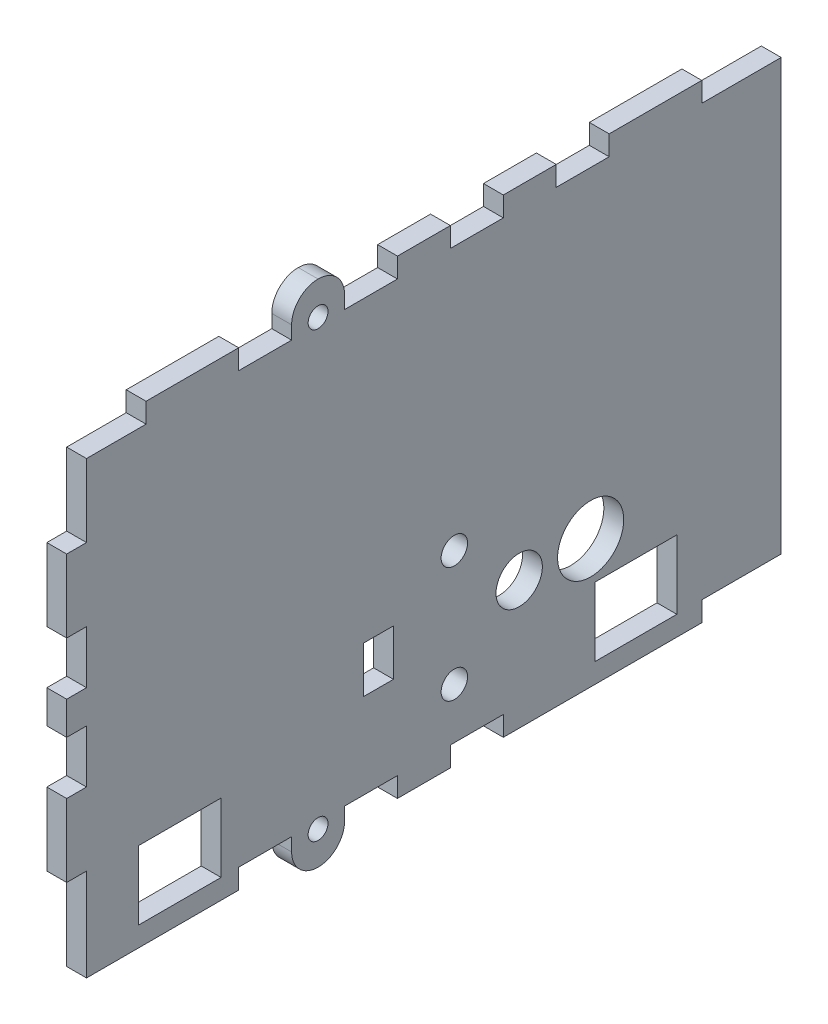
from build123d import *

# Parameters (mm, degrees)
CROQUIS1_W               = 108
CROQUIS1_H               = 71
SALIENTE_EXTRUIR1_DEPTH  = 1.5
CROQUIS2_W               = 12
CROQUIS2_H               = 3
CROQUIS2_W_2             = 8
CORTAR_EXTRUIR1_DEPTH    = 3
CROQUIS6_W               = 3
CROQUIS6_H               = 14
CROQUIS6_H_2             = 8
CORTAR_EXTRUIR3_DEPTH    = 3
CROQUIS8_W               = 8
CROQUIS8_H               = 3
SALIENTE_EXTRUIR2_DEPTH  = 3
REDONDEO2_R              = 4
CROQUIS9_R               = 1.5
CORTAR_EXTRUIR5_DEPTH    = 3
REDONDEO2_OF_SIMETR_A1_R = 4
CROQUIS12_W              = 12.481361742
CROQUIS12_H              = 10.4
CROQUIS12_W_2            = 12.356019523
CORTAR_EXTRUIR7_DEPTH    = 10
CROQUIS10_R              = 4.6
CROQUIS10_R_2            = 3.5
CROQUIS10_R_3            = 2
CROQUIS10_W              = 4.5
CROQUIS10_H              = 7
CORTAR_EXTRUIR6_DEPTH    = 10
CROQUIS14_R              = 5
CROQUIS14_R_2            = 0.007419035
CORTAR_EXTRUIR9_DEPTH    = 10


with BuildPart() as part:
    # Croquis1 → Saliente-Extruir1 (new, symmetric)
    with BuildSketch(Plane(origin=(0, 0, 0), x_dir=(0, 0, -1), z_dir=(1, 0, 0))):
        Rectangle(CROQUIS1_W, CROQUIS1_H)
    extrude(amount=SALIENTE_EXTRUIR1_DEPTH, both=True)

    # Croquis2 → Cortar-Extruir1 (cut)
    with BuildSketch(Plane.ZY.offset(1.5)):
        with Locations((-48, -34)):
            Rectangle(CROQUIS2_W, CROQUIS2_H)
        with Locations((-8, -34)):
            Rectangle(CROQUIS2_W_2, CROQUIS2_H)
        with Locations((48, 34)):
            Rectangle(CROQUIS2_W, CROQUIS2_H)
        with Locations((24, 34)):
            Rectangle(CROQUIS2_W_2, CROQUIS2_H)
        with Locations((8, 34)):
            Rectangle(CROQUIS2_W_2, CROQUIS2_H)
        with Locations((-8, 34)):
            Rectangle(CROQUIS2_W_2, CROQUIS2_H)
        with Locations((-24, 34)):
            Rectangle(CROQUIS2_W_2, CROQUIS2_H)
        with Locations((-48, 34)):
            Rectangle(CROQUIS2_W, CROQUIS2_H)
        with Locations((8, -34)):
            Rectangle(CROQUIS2_W_2, CROQUIS2_H)
        with Locations((24, -34)):
            Rectangle(CROQUIS2_W_2, CROQUIS2_H)
    extrude(amount=-CORTAR_EXTRUIR1_DEPTH, mode=Mode.SUBTRACT)

    # Croquis6 → Cortar-Extruir3 (cut)
    with BuildSketch(Plane.ZY.offset(1.5)):
        with Locations((52.5, -28.5)):
            Rectangle(CROQUIS6_W, CROQUIS6_H)
        with Locations((52.5, -6.5)):
            Rectangle(CROQUIS6_W, CROQUIS6_H_2)
        with Locations((52.5, 6.5)):
            Rectangle(CROQUIS6_W, CROQUIS6_H_2)
        with Locations((52.5, 28.5)):
            Rectangle(CROQUIS6_W, CROQUIS6_H)
    extrude(amount=-CORTAR_EXTRUIR3_DEPTH, mode=Mode.SUBTRACT)

    # Croquis8 → Saliente-Extruir2 (add)
    with BuildSketch(Plane.ZY.offset(1.5)):
        with Locations((16, 37)):
            Rectangle(CROQUIS8_W, CROQUIS8_H)
    saliente_extruir2 = extrude(amount=-SALIENTE_EXTRUIR2_DEPTH)

    # Redondeo2
    redondeo2_edges = [part.edges().sort_by_distance(p)[0] for p in [
        (0, 38.5, 20),
        (0, 38.5, 12),
    ]]
    fillet(redondeo2_edges, radius=REDONDEO2_R - 0.0001)  # a hair under: the kernel refuses the full size

    # Croquis9 → Cortar-Extruir5 (cut)
    with BuildSketch(Plane.ZY.offset(1.5)):
        with Locations((16, 33.5)):
            Circle(CROQUIS9_R)
    cortar_extruir5 = extrude(amount=-CORTAR_EXTRUIR5_DEPTH, mode=Mode.SUBTRACT)

    # Simetría1: Saliente-Extruir2, Cortar-Extruir5 across plane
    add(saliente_extruir2.mirror(Plane.ZX))
    add(cortar_extruir5.mirror(Plane.ZX), mode=Mode.SUBTRACT)

    # Redondeo2 of Simetría1
    redondeo2_of_simetr_a1_edges = [part.edges().sort_by_distance(p)[0] for p in [
        (0, -38.5, 20),
        (0, -38.5, 12),
    ]]
    fillet(redondeo2_of_simetr_a1_edges, radius=REDONDEO2_OF_SIMETR_A1_R - 0.0001)  # a hair under: the kernel refuses the full size

    # Croquis12 → Cortar-Extruir7 (cut)
    with BuildSketch(Plane.ZY.offset(1.5)):
        with Locations((36.9, -27.305454422)):
            Rectangle(CROQUIS12_W, CROQUIS12_H)
        with Locations((-32.051890368, -27.305454422)):
            Rectangle(CROQUIS12_W_2, CROQUIS12_H)
    extrude(amount=-CORTAR_EXTRUIR7_DEPTH, mode=Mode.SUBTRACT)

    # Croquis10 → Cortar-Extruir6 (cut)
    with BuildSketch(Plane.ZY.offset(1.5)):
        with Locations((-25.2, -16.1)):
            Circle(CROQUIS10_R)
        with Locations((-14.4, -16.1)):
            Circle(CROQUIS10_R_2)
        with Locations((-4.6, -24.85)):
            Circle(CROQUIS10_R_3)
        with Locations((6.85, -16.1)):
            Rectangle(CROQUIS10_W, CROQUIS10_H)
        with Locations((-4.6, -7.35)):
            Circle(CROQUIS10_R_3)
    extrude(amount=-CORTAR_EXTRUIR6_DEPTH, mode=Mode.SUBTRACT)

    # Croquis14 → Cortar-Extruir9 (cut)
    with BuildSketch(Plane(origin=(1.5, 0, 0), x_dir=(0, 0, -1), z_dir=(1, 0, 0))):
        with Locations((25.2, -16.1)):
            Circle(CROQUIS14_R)
        with Locations((21.161787618, -13.912617849)):
            Circle(CROQUIS14_R_2, mode=Mode.SUBTRACT)
    extrude(amount=-CORTAR_EXTRUIR9_DEPTH, mode=Mode.SUBTRACT)


solid = part.part
